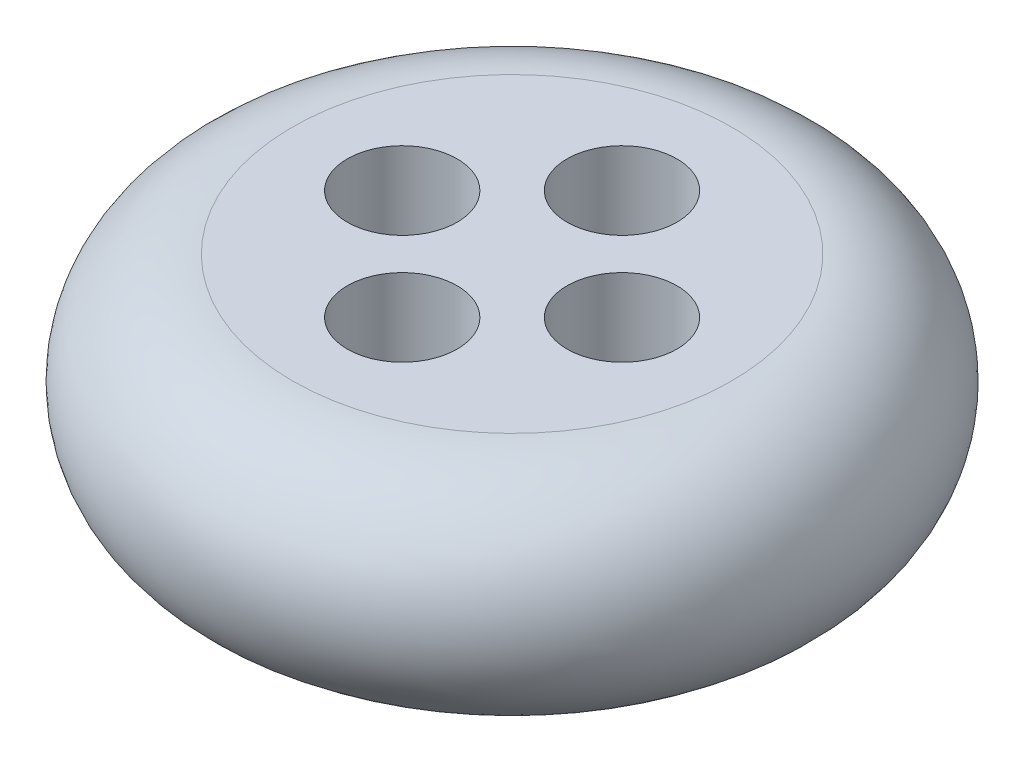
from build123d import *

# Parameters (mm, degrees)
SKETCH_1_R      = 15
SKETCH_1_R_2    = 2.5
EXTRUDE_1_DEPTH = 10
FILLET_1_R      = 5


with BuildPart() as part:
    # 草图1 → 凸台-拉伸1 (new body)
    with BuildSketch(Plane(origin=(0, 0, 0), x_dir=(1, 0, 0), z_dir=(0, 1, 0))):
        with Locations(Location((0, 0, 0), (0, 0, 270))):
            Circle(SKETCH_1_R)
        with Locations(Location((0, 5, 0), (0, 0, 270))):
            Circle(SKETCH_1_R_2, mode=Mode.SUBTRACT)
        with Locations(Location((0, -5, 0), (0, 0, 270))):
            Circle(SKETCH_1_R_2, mode=Mode.SUBTRACT)
        with Locations(Location((5, 0, 0), (0, 0, 270))):
            Circle(SKETCH_1_R_2, mode=Mode.SUBTRACT)
        with Locations(Location((-5, 0, 0), (0, 0, 270))):
            Circle(SKETCH_1_R_2, mode=Mode.SUBTRACT)
    extrude(amount=EXTRUDE_1_DEPTH)

    # 圆角1
    fillet_1_edges = [part.edges().sort_by_distance(p)[0] for p in [
        (0, 0, -15),
        (0, 10, -15),
    ]]
    fillet(fillet_1_edges, radius=FILLET_1_R - 0.0001)  # a hair under: the kernel refuses the full size


solid = part.part
